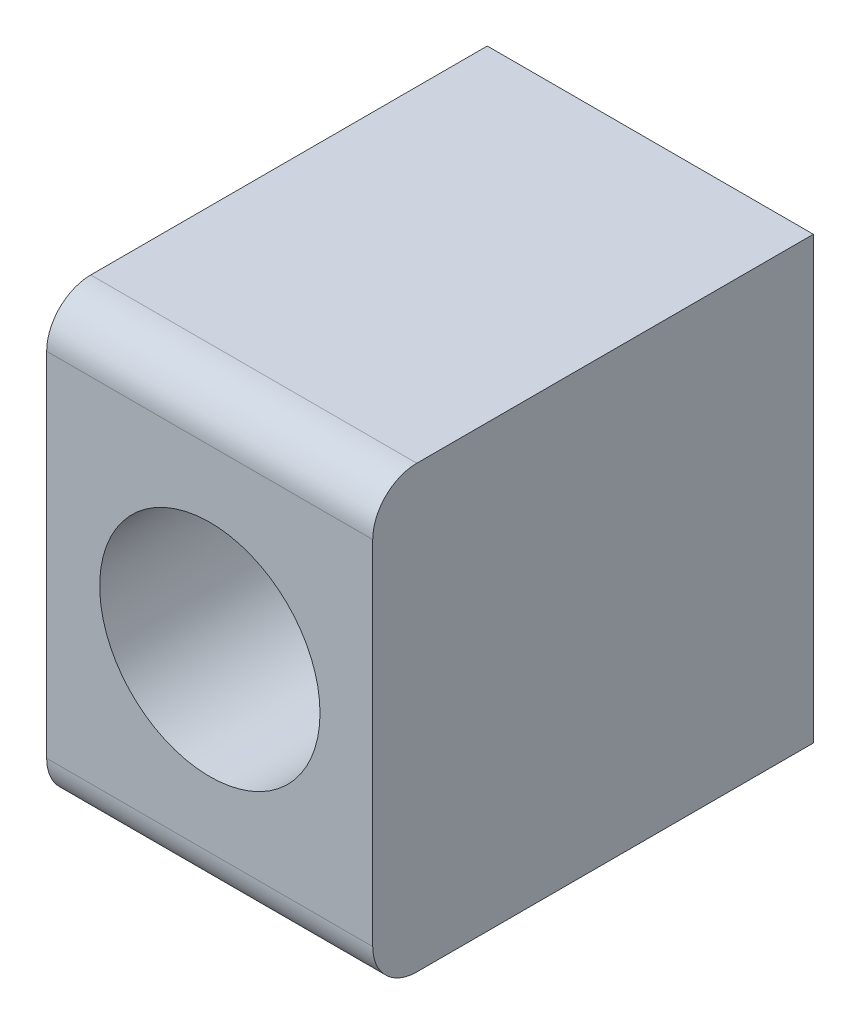
from build123d import *

# Parameters (mm, degrees)
SKETCH_1_W          = 15
SKETCH_1_H          = 20
EXTRUDE_1_DEPTH     = 20
SKETCH_5_R          = 5
SKETCH_5_R_2        = 2.75
CUT_EXTRUDE_1_DEPTH = 16
SKETCH_6_R          = 2.75
CUT_EXTRUDE_2_DEPTH = 28.271229432
FILLET_2_R          = 2
CUT_EXTRUDE_4_DEPTH = 0.1
CUT_EXTRUDE_5_DEPTH = 0.1


with BuildPart() as part:
    # 草图1 → 凸台-拉伸1 (new body)
    with BuildSketch(Plane.XY):
        with Locations((2.694174757, -5.485436893)):
            Rectangle(SKETCH_1_W, SKETCH_1_H)
    extrude(amount=EXTRUDE_1_DEPTH)

    # 草图5 → 切除-拉伸1 (cut)
    with BuildSketch(Plane.XY.offset(20)):
        with Locations((2.701438281, -5.503140696)):
            Circle(SKETCH_5_R)
        with Locations((2.701438281, -5.503140696)):
            Circle(SKETCH_5_R_2, mode=Mode.SUBTRACT)
    extrude(amount=-CUT_EXTRUDE_1_DEPTH, mode=Mode.SUBTRACT)

    # 草图6 → 切除-拉伸2 (cut, through all)
    with BuildSketch(Plane.XY.offset(20)):
        with Locations((2.701438281, -5.503140696)):
            Circle(SKETCH_6_R)
    extrude(amount=-CUT_EXTRUDE_2_DEPTH, mode=Mode.SUBTRACT)

    # 变化圆角2
    fillet_2_edges = [part.edges().sort_by_distance(p)[0] for p in [
        (2.694174757, -15.485436893, 20),
        (2.694174757, 4.514563107, 20),
    ]]
    fillet(fillet_2_edges, radius=FILLET_2_R)

    # 草图7 → 切除-拉伸4 (cut)
    with BuildSketch(Plane.ZY.offset(4.805825243)):
        with BuildLine():
            Line((0, -15.485436893), (18, -15.485436893))
            ThreePointArc((18, -15.485436893), (19.414213562, -14.899650456), (20, -13.485436893))
            Line((20, -13.485436893), (20, 2.514563107))
            ThreePointArc((20, 2.514563107), (19.414213562, 3.928776669), (18, 4.514563107))
            Line((18, 4.514563107), (0, 4.514563107))
            Line((0, 4.514563107), (0, -15.485436893))
        make_face()
    extrude(amount=-CUT_EXTRUDE_4_DEPTH, mode=Mode.SUBTRACT)

    # 草图8 → 切除-拉伸5 (cut)
    with BuildSketch(Plane(origin=(10.194174757, 0, 0), x_dir=(0, 0, -1), z_dir=(1, 0, 0))):
        with BuildLine():
            Line((-20, 2.514563107), (-20, -13.485436893))
            ThreePointArc((-20, -13.485436893), (-19.414213562, -14.899650456), (-18, -15.485436893))
            Line((-18, -15.485436893), (0, -15.485436893))
            Line((0, -15.485436893), (0, 4.514563107))
            Line((0, 4.514563107), (-18, 4.514563107))
            ThreePointArc((-18, 4.514563107), (-19.414213562, 3.928776669), (-20, 2.514563107))
        make_face()
    extrude(amount=-CUT_EXTRUDE_5_DEPTH, mode=Mode.SUBTRACT)


solid = part.part
